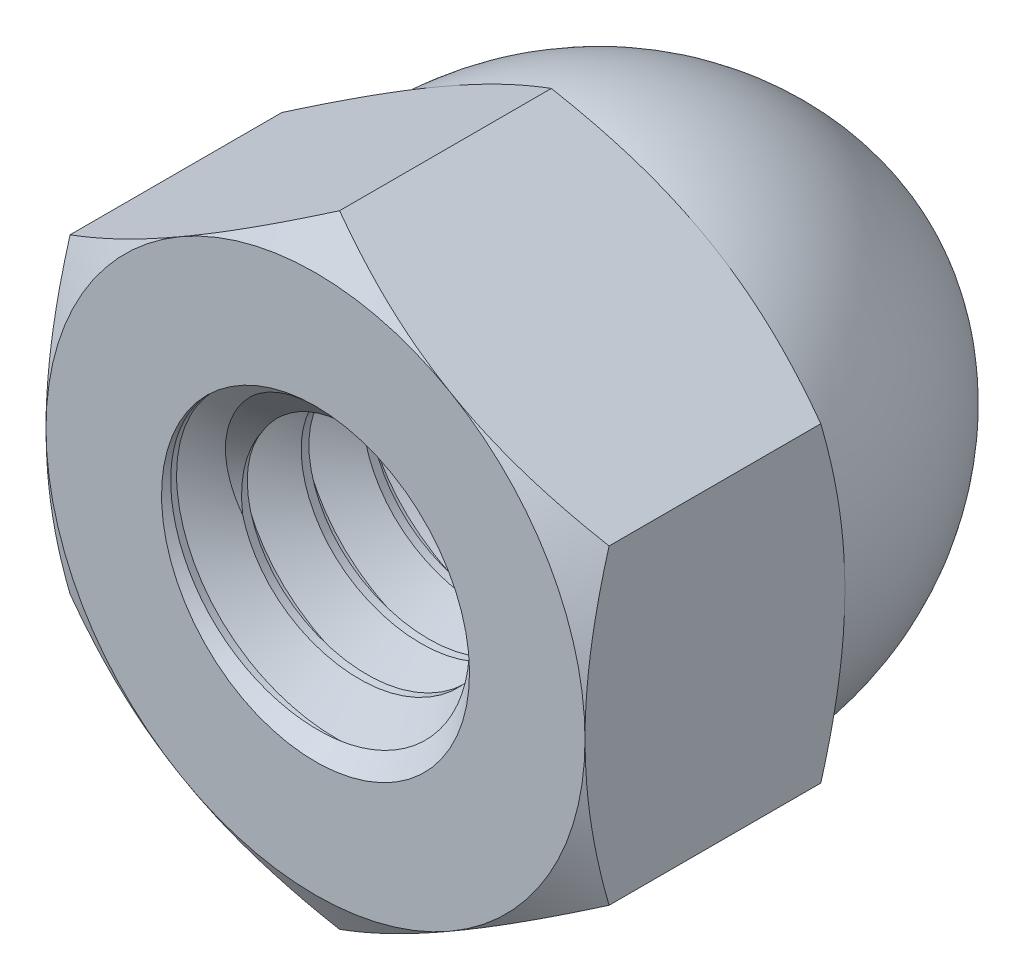
from build123d import *

# Parameters (mm, degrees)
EXTRUDE1_DEPTH     = 5.3578125
SKETCH2_OUTSIDE_W  = 54.906
SKETCH2_OUTSIDE_H  = 56.626
SKETCH2_OUTSIDE_R  = 5.55625
CUT_EXTRUDE1_DEPTH = 11.036962734
CUT_EXTRUDE1_DRAFT = -60
SKETCH3_OUTSIDE_W  = 54.906
SKETCH3_OUTSIDE_H  = 56.626
SKETCH3_OUTSIDE_R  = 5.55625
CUT_EXTRUDE2_DEPTH = 11.036962734
CUT_EXTRUDE2_DRAFT = -60
SKETCH4_R          = 3.175
CUT_EXTRUDE3_DEPTH = 6.35
SWEEP1_PITCH       = 1.27
CUT_EXTRUDE8_DEPTH = 15.621670777


with BuildPart() as part:
    # Sketch1 → Extrude1 (new body)
    with BuildSketch(Plane.XY):
        Polygon((0, 6.415804866), (-5.55625, 3.207902433), (-5.55625, -3.207902433), (0, -6.415804866), (5.55625, -3.207902433), (5.55625, 3.207902433), align=None)
    extrude(amount=-EXTRUDE1_DEPTH)


with BuildPart() as cut_extrude1_tool:
    # Sketch2 outside → Cut-Extrude1 (with draft: the straight prism first)
    with BuildSketch(Plane.XY):
        Rectangle(SKETCH2_OUTSIDE_W, SKETCH2_OUTSIDE_H)
        Circle(SKETCH2_OUTSIDE_R, mode=Mode.SUBTRACT)
    extrude(amount=-CUT_EXTRUDE1_DEPTH)
    # Cut-Extrude1: the draft: its side faces are tilted about the plane it starts from
    cut_extrude1_sides = [cut_extrude1_tool.faces().sort_by_distance(p)[0] for p in [
        (0, -28.313, -5.518481367),
        (27.453, 0, -5.518481367),
        (0, 28.313, -5.518481367),
        (-27.453, 0, -5.518481367),
        (-5.55625, 0, -5.518481367),
    ]]
    draft(cut_extrude1_sides, Plane.XY, CUT_EXTRUDE1_DRAFT)


with BuildPart() as part_1:
    add(part.part)

    # Cut-Extrude1: cut by cut_extrude1_tool
    add(cut_extrude1_tool.part, mode=Mode.SUBTRACT)


with BuildPart() as cut_extrude2_tool:
    # Sketch3 outside → Cut-Extrude2 (with draft: the straight prism first)
    with BuildSketch(Plane(origin=(0, 0, -5.3578125), x_dir=(-1, 0, 0), z_dir=(0, 0, -1))):
        Rectangle(SKETCH3_OUTSIDE_W, SKETCH3_OUTSIDE_H)
        Circle(SKETCH3_OUTSIDE_R, mode=Mode.SUBTRACT)
    extrude(amount=-CUT_EXTRUDE2_DEPTH)
    # Cut-Extrude2: the draft: its side faces are tilted about the plane it starts from
    cut_extrude2_sides = [cut_extrude2_tool.faces().sort_by_distance(p)[0] for p in [
        (0, -28.313, 0.160668867),
        (-27.453, 0, 0.160668867),
        (0, 28.313, 0.160668867),
        (27.453, 0, 0.160668867),
        (5.55625, 0, 0.160668867),
    ]]
    draft(cut_extrude2_sides, Plane(origin=(0, 0, -5.3578125), x_dir=(-1, 0, 0), z_dir=(0, 0, -1)), CUT_EXTRUDE2_DRAFT)


with BuildPart() as part_2:
    add(part_1.part)

    # Cut-Extrude2: cut by cut_extrude2_tool
    add(cut_extrude2_tool.part, mode=Mode.SUBTRACT)

    # Sketch14 → Revolve1 (revolve)
    with BuildSketch(Plane(origin=(0, 0, 0), x_dir=(0, 0, -1), z_dir=(1, 0, 0))):
        with BuildLine():
            Line((5.3578125, 5.55625), (5.3578125, 0))
            Line((5.3578125, 0), (11.90625, 0))
            ThreePointArc((11.90625, 0), (9.651818431, 3.980017035), (5.3578125, 5.55625))
        make_face()
    revolve(axis=Axis((0, 0, 0), (0, 0, -1)))

    # Sketch4 → Cut-Extrude3 (cut)
    with BuildSketch(Plane.XY):
        Circle(SKETCH4_R)
    extrude(amount=-CUT_EXTRUDE3_DEPTH, mode=Mode.SUBTRACT)

    # Sweep1: the profile of Sketch16 profile screwed along a left-hand helix of 7.5 turns, 6 arcs to a turn; built about Z, then put on its axis
    sweep1_z = Axis((0, 0, 0), (0, 0, 1))
    sweep1_corners = [(3.1753, 0, 0.000173205), (3.1753, 0, -1.111423205), (2.350110803, 0, -0.635), (2.350110803, 0, -0.47625)]
    with BuildLine(mode=Mode.PRIVATE) as sweep1_profile:
        Line(sweep1_corners[0], sweep1_corners[1])
        Line(sweep1_corners[1], sweep1_corners[2])
        Line(sweep1_corners[2], sweep1_corners[3])
        Line(sweep1_corners[3], sweep1_corners[0])
    sweep1_cap = Face(sweep1_profile.wire())
    sweep1_turn_angles = [0, -30, -60, -90, -120, -150, -180, -210, -240, -270, -300, -330, -360]
    sweep1_turn_weights = [1, 0.8660254037844387, 1, 0.8660254037844387, 1, 0.8660254037844387, 1, 0.8660254037844387, 1, 0.8660254037844387, 1, 0.8660254037844387, 1]
    sweep1_turn_rails = [Edge.make_bspline([Vector(p[0], p[1], 0).rotate(sweep1_z, sweep1_turn_angles[k]) / sweep1_turn_weights[k] + Vector(0, 0, p[2] + -SWEEP1_PITCH * sweep1_turn_angles[k] / 360) for k in range(13)], [0, 0, 0, 1, 1, 2, 2, 3, 3, 4, 4, 5, 5, 6, 6, 6], 2, sweep1_turn_weights) for p in sweep1_corners]
    sweep1_turn_sides = [Face.make_surface_from_curves(sweep1_turn_rails[p[0]], sweep1_turn_rails[p[1]]) for p in [(0, 1), (1, 2), (2, 3), (3, 0)]]
    sweep1_last_angles = [-2520, -2550, -2580, -2610, -2640, -2670, -2700]
    sweep1_last_weights = [1, 0.8660254037844387, 1, 0.8660254037844387, 1, 0.8660254037844446, 1]
    sweep1_last_rails = [Edge.make_bspline([Vector(p[0], p[1], 0).rotate(sweep1_z, sweep1_last_angles[k]) / sweep1_last_weights[k] + Vector(0, 0, p[2] + -SWEEP1_PITCH * sweep1_last_angles[k] / 360) for k in range(7)], [0, 0, 0, 1, 1, 2, 2, 3, 3, 3], 2, sweep1_last_weights) for p in sweep1_corners]
    sweep1_last_sides = [Face.make_surface_from_curves(sweep1_last_rails[p[0]], sweep1_last_rails[p[1]]) for p in [(0, 1), (1, 2), (2, 3), (3, 0)]]
    sweep1 = Plane(origin=(0, 0, -6.35), x_dir=(0, 1, 0), z_dir=(0, 0, 1)) * Solid(Shell([*[p.moved(Location((0, 0, SWEEP1_PITCH * i))) for i in range(7) for p in sweep1_turn_sides], *sweep1_last_sides, sweep1_cap, sweep1_cap.rotate(sweep1_z, -2700).moved(Location((0, 0, -SWEEP1_PITCH * -2700 / 360)))]))
    add(sweep1)

    # Sketch17 → Cut-Extrude8 (cut, through all)
    with BuildSketch(Plane.XY):
        Polygon((0, 6.415804866), (-5.55625, 3.207902433), (-5.55625, -3.207902433), (0, -6.415804866), (5.55625, -3.207902433), (5.55625, 3.207902433), align=None)
    extrude(amount=CUT_EXTRUDE8_DEPTH, mode=Mode.SUBTRACT)

    # Cut-Extrude9 cone 1 section (through the dimple's axis) → Cut-Extrude9 (revolve, cut)
    with BuildSketch(Plane(origin=(0, 0, 0), x_dir=(0, -1, 0), z_dir=(1, 0, 0))):
        Polygon((0, 0), (3.175, 0), (0, 3.175), align=None)
    revolve(axis=Axis((0, 0, 0), (0, 0, -1)), mode=Mode.SUBTRACT)

    # Sketch20 → Cut-Revolve1 (revolve, cut)
    with BuildSketch(Plane(origin=(0, 0, 0), x_dir=(0, 0, -1), z_dir=(1, 0, 0))):
        Polygon((6.985, 3.175), (8.818087105, 0), (6.35, 0), (6.35, 3.175), align=None)
    revolve(axis=Axis((0, 0, 0), (0, 0, 1)), mode=Mode.SUBTRACT)


solid = part_2.part
